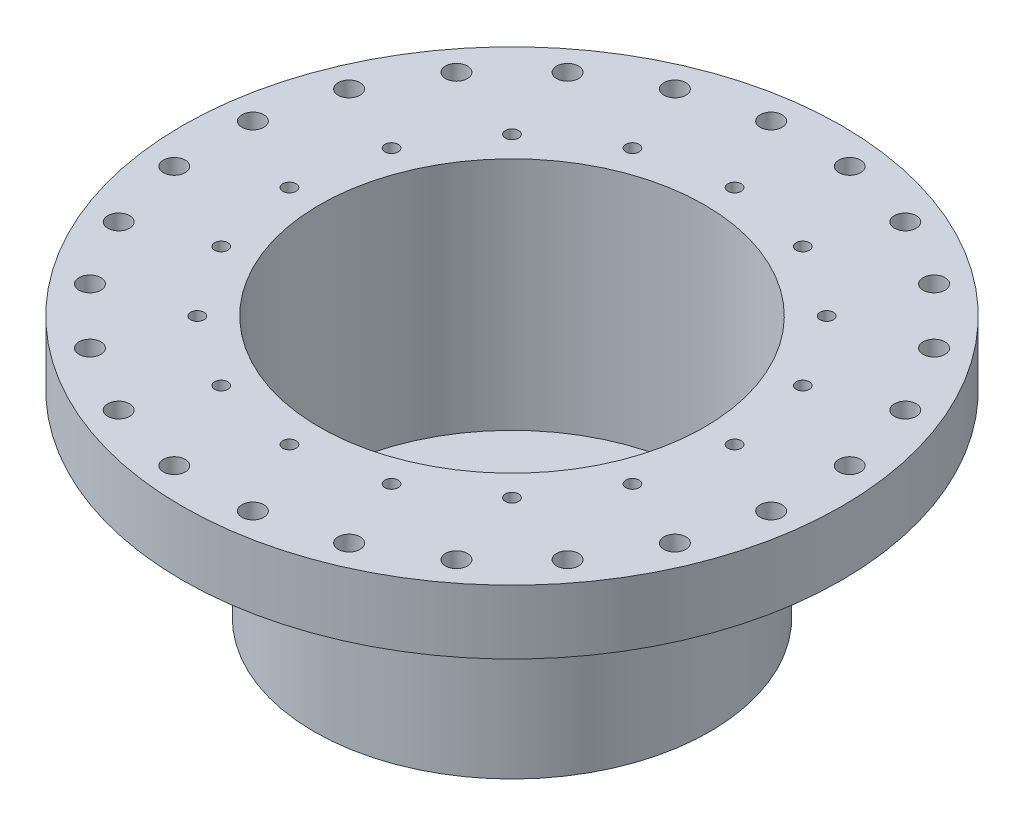
from build123d import *

# Parameters (mm, degrees)
SKETCH1_R               = 76.2
EXTRUDE1_DEPTH          = 75.946
SKETCH2_R               = 127
EXTRUDE2_DEPTH          = 24.638
CUT_EXTRUDE1_DEPTH      = 196.002038236
CUT_EXTRUDE1_DEPTH_BACK = 65.9384
SKETCH3_R               = 74.168
SKETCH4_R               = 50.8
CUT_EXTRUDE2_DEPTH      = 196.002038236
CIRPATTERN2_COUNT       = 16
SKETCH5_R               = 4.2164
CUT_EXTRUDE5_DEPTH      = 196.002038236
CIRPATTERN3_COUNT       = 24


with BuildPart() as part:
    # Sketch1 → Extrude1 (new body)
    with BuildSketch(Plane(origin=(0, 0, 0), x_dir=(1, 0, 0), z_dir=(0, 1, 0))):
        Circle(SKETCH1_R)
    extrude(amount=-EXTRUDE1_DEPTH)

    # Sketch2 → Extrude2 (add)
    with BuildSketch(Plane(origin=(0, 0, 0), x_dir=(1, 0, 0), z_dir=(0, 1, 0))):
        Circle(SKETCH2_R)
    extrude(amount=EXTRUDE2_DEPTH)

    # Sketch3 → Cut-Extrude1 (cut, two sides: drawn at the far end of the back side and taken through both)
    with BuildSketch(Plane(origin=(0, 0, 0), x_dir=(1, 0, 0), z_dir=(0, 1, 0)).offset(-CUT_EXTRUDE1_DEPTH_BACK)):
        Circle(SKETCH3_R)
    extrude(amount=CUT_EXTRUDE1_DEPTH + CUT_EXTRUDE1_DEPTH_BACK, mode=Mode.SUBTRACT)

    # Sketch4 → Cut-Extrude2 (cut, through all)
    with BuildSketch(Plane(origin=(0, 0, 0), x_dir=(1, 0, 0), z_dir=(0, 1, 0))):
        Circle(SKETCH4_R)
    extrude(amount=-CUT_EXTRUDE2_DEPTH, mode=Mode.SUBTRACT)

    # Sketch11 → 1/4-20 Tapped Hole1 (revolve, cut)
    with BuildSketch(Plane(origin=(0, 24.638, -85.725), x_dir=(0, 0, 1), z_dir=(1, 0, 0))):
        Polygon((0, 0), (0, 18.043816902), (2.5527, 16.51), (2.5527, 0), align=None)
    f_1_4_20_tapped_hole1 = revolve(axis=Axis((0, 30.988, -85.725), (0, -1, 0)), mode=Mode.SUBTRACT)

    # CirPattern2: 1/4-20 Tapped Hole1 ×16 about axis
    cirpattern2_axis = Axis((0, 130.393318878, 0), (0, -1, 0))
    for i in range(1, CIRPATTERN2_COUNT):
        add(f_1_4_20_tapped_hole1.rotate(cirpattern2_axis, i * 360 / CIRPATTERN2_COUNT), mode=Mode.SUBTRACT)

    # Sketch5 → Cut-Extrude5 (cut, through all)
    with BuildSketch(Plane(origin=(0, 0, 0), x_dir=(1, 0, 0), z_dir=(0, 1, 0))):
        with Locations((-15.134642514, 114.959023121)):
            Circle(SKETCH5_R)
    cut_extrude5 = extrude(amount=CUT_EXTRUDE5_DEPTH, mode=Mode.SUBTRACT)

    # CirPattern3: Cut-Extrude5 ×24 about axis
    cirpattern3_axis = Axis((0, 130.393318878, 0), (0, -1, 0))
    for i in range(1, CIRPATTERN3_COUNT):
        add(cut_extrude5.rotate(cirpattern3_axis, i * 360 / CIRPATTERN3_COUNT), mode=Mode.SUBTRACT)


solid = part.part
